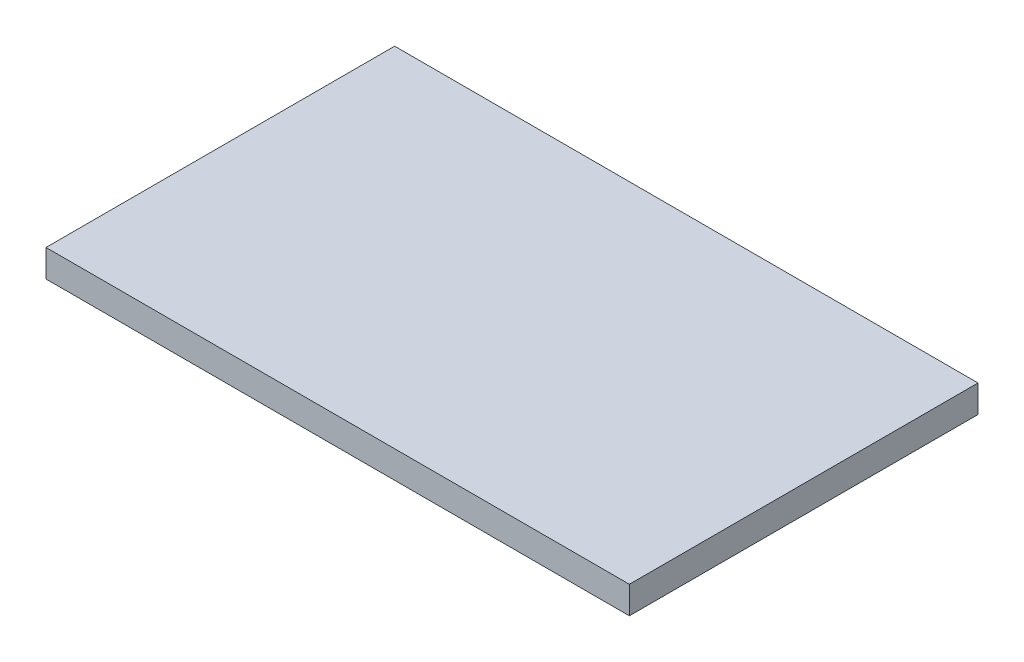
from build123d import *

# Parameters (mm, degrees)
BOSS_EXTRUDE1_DEPTH = 2.4


with BuildPart() as part:
    # Sketch1 → Boss-Extrude1 (new body)
    with BuildSketch(Plane(origin=(0, 0, 0), x_dir=(1, 0, 0), z_dir=(0, 1, 0))):
        Polygon((-25.6, 14.1), (-25.6, -14.1), (25.6, -14.1), (25.6, 14.1), (25.6, 16.5), (-25.6, 16.5), align=None)
    extrude(amount=BOSS_EXTRUDE1_DEPTH)


solid = part.part
